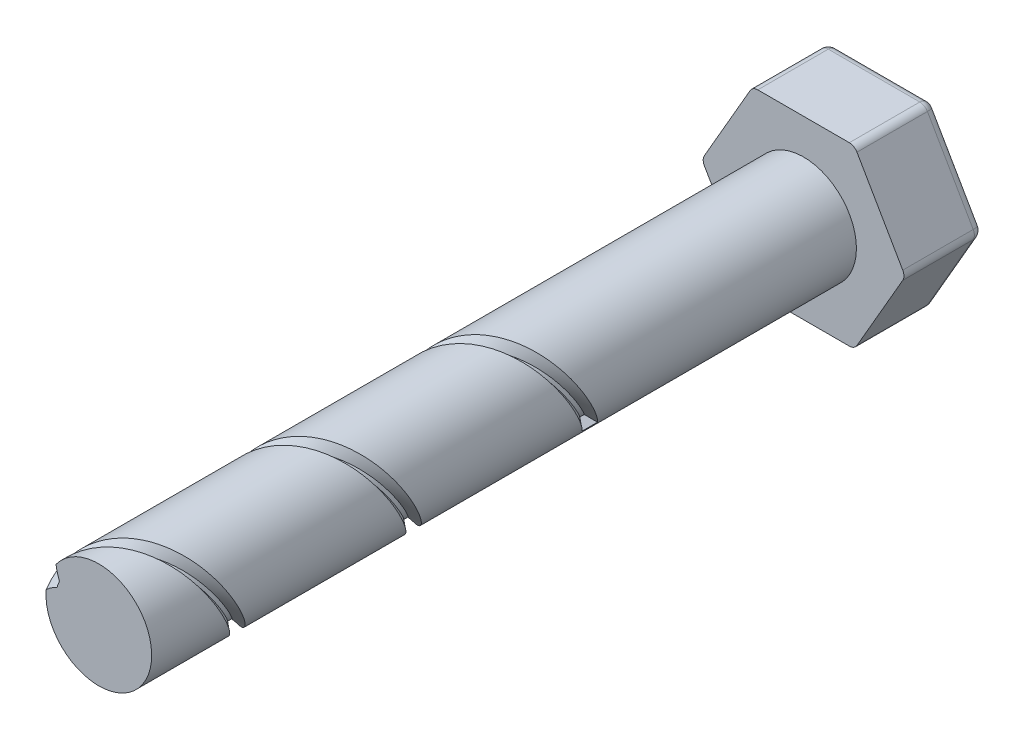
from build123d import *

# Parameters (mm, degrees)
SKETCH1_R           = 3
BOSS_EXTRUDE1_DEPTH = 40
BOSS_EXTRUDE2_DEPTH = 4.5
FILLET1_R           = 0.5
THREAD1_PITCH       = 10


with BuildPart() as part:
    # Sketch1 → Boss-Extrude1 (new body)
    with BuildSketch(Plane.XY):
        Circle(SKETCH1_R)
    extrude(amount=BOSS_EXTRUDE1_DEPTH)

    # Sketch2 → Boss-Extrude2 (add)
    with BuildSketch(Plane(origin=(0, 0, 0), x_dir=(-1, 0, 0), z_dir=(0, 0, -1))):
        Polygon((5.773502692, 0), (2.886751346, 5), (-2.886751346, 5), (-5.773502692, 0), (-2.886751346, -5), (2.886751346, -5), align=None)
    extrude(amount=BOSS_EXTRUDE2_DEPTH)

    # Fillet1
    fillet1_edges = [part.edges().sort_by_distance(p)[0] for p in [
        (-2.886751346, -5, -2.25),
        (-5.773502692, 0, -2.25),
        (-2.886751346, 5, -2.25),
        (2.886751346, 5, -2.25),
        (5.773502692, 0, -2.25),
        (2.886751346, -5, -2.25),
        (-4.330127019, -2.5, -4.5),
        (-4.330127019, 2.5, -4.5),
        (0, 5, -4.5),
        (4.330127019, 2.5, -4.5),
        (4.330127019, -2.5, -4.5),
        (0, -5, -4.5),
    ]]
    fillet(fillet1_edges, radius=FILLET1_R)

    # Thread1: arcs per turn and ends read off the stored shape
    # Thread1: the profile of Thread Profile1 profile screwed along a right-hand helix through 2.599994 turns, 16 arcs to a turn; built about Z, then put on its axis
    thread1_z = Axis((0, 0, 0), (0, 0, 1))
    thread1_corners = [(3.0003, 0, -0.000173205), (3.0003, 0, 0.875173202), (2.458734125, 0, 0.562499999), (2.458734125, 0, 0.312499999)]
    with BuildLine(mode=Mode.PRIVATE) as thread1_profile:
        Line(thread1_corners[0], thread1_corners[1])
        Line(thread1_corners[1], thread1_corners[2])
        Line(thread1_corners[2], thread1_corners[3])
        Line(thread1_corners[3], thread1_corners[0])
    thread1_cap = Face(thread1_profile.wire())
    thread1_turn_angles = [0, 11.25, 22.5, 33.75, 45, 56.25, 67.5, 78.75, 90, 101.25, 112.5, 123.75, 135, 146.25, 157.5, 168.75, 180, 191.25, 202.5, 213.75, 225, 236.25, 247.5, 258.75, 270, 281.25, 292.5, 303.75, 315, 326.25, 337.5, 348.75, 360]
    thread1_turn_weights = [1, 0.9807852804032304, 1, 0.9807852804032304, 1, 0.9807852804032304, 1, 0.9807852804032304, 1, 0.9807852804032304, 1, 0.9807852804032304, 1, 0.9807852804032304, 1, 0.9807852804032304, 1, 0.9807852804032304, 1, 0.9807852804032304, 1, 0.9807852804032304, 1, 0.9807852804032304, 1, 0.9807852804032304, 1, 0.9807852804032304, 1, 0.9807852804032304, 1, 0.9807852804032304, 1]
    thread1_turn_rails = [Edge.make_bspline([Vector(p[0], p[1], 0).rotate(thread1_z, thread1_turn_angles[k]) / thread1_turn_weights[k] + Vector(0, 0, p[2] + THREAD1_PITCH * thread1_turn_angles[k] / 360) for k in range(33)], [0, 0, 0, 1, 1, 2, 2, 3, 3, 4, 4, 5, 5, 6, 6, 7, 7, 8, 8, 9, 9, 10, 10, 11, 11, 12, 12, 13, 13, 14, 14, 15, 15, 16, 16, 16], 2, thread1_turn_weights) for p in thread1_corners]
    thread1_turn_sides = [Face.make_surface_from_curves(thread1_turn_rails[p[0]], thread1_turn_rails[p[1]]) for p in [(0, 1), (1, 2), (2, 3), (3, 0)]]
    thread1_last_angles = [720, 731.25, 742.5, 753.75, 765, 776.25, 787.5, 798.75, 810, 821.25, 832.5, 843.75, 855, 866.25, 877.5, 888.75, 900, 911.25, 922.5, 929.249, 935.998]
    thread1_last_weights = [1, 0.9807852804032304, 1, 0.9807852804032304, 1, 0.9807852804032304, 1, 0.9807852804032304, 1, 0.9807852804032304, 1, 0.9807852804032304, 1, 0.9807852804032304, 1, 0.9807852804032304, 1, 0.9807852804032304, 1, 0.993070508218253, 1]
    thread1_last_rails = [Edge.make_bspline([Vector(p[0], p[1], 0).rotate(thread1_z, thread1_last_angles[k]) / thread1_last_weights[k] + Vector(0, 0, p[2] + THREAD1_PITCH * thread1_last_angles[k] / 360) for k in range(21)], [0, 0, 0, 1, 1, 2, 2, 3, 3, 4, 4, 5, 5, 6, 6, 7, 7, 8, 8, 9, 9, 10, 10, 10], 2, thread1_last_weights) for p in thread1_corners]
    thread1_last_sides = [Face.make_surface_from_curves(thread1_last_rails[p[0]], thread1_last_rails[p[1]]) for p in [(0, 1), (1, 2), (2, 3), (3, 0)]]
    thread1 = Plane(origin=(0, 0, 41), x_dir=(-1, 0, 0), z_dir=(0, 0, -1)) * Solid(Shell([*[p.moved(Location((0, 0, THREAD1_PITCH * i))) for i in range(2) for p in thread1_turn_sides], *thread1_last_sides, thread1_cap, thread1_cap.rotate(thread1_z, 935.998).moved(Location((0, 0, THREAD1_PITCH * 935.998 / 360)))]))
    add(thread1, mode=Mode.SUBTRACT)


solid = part.part
